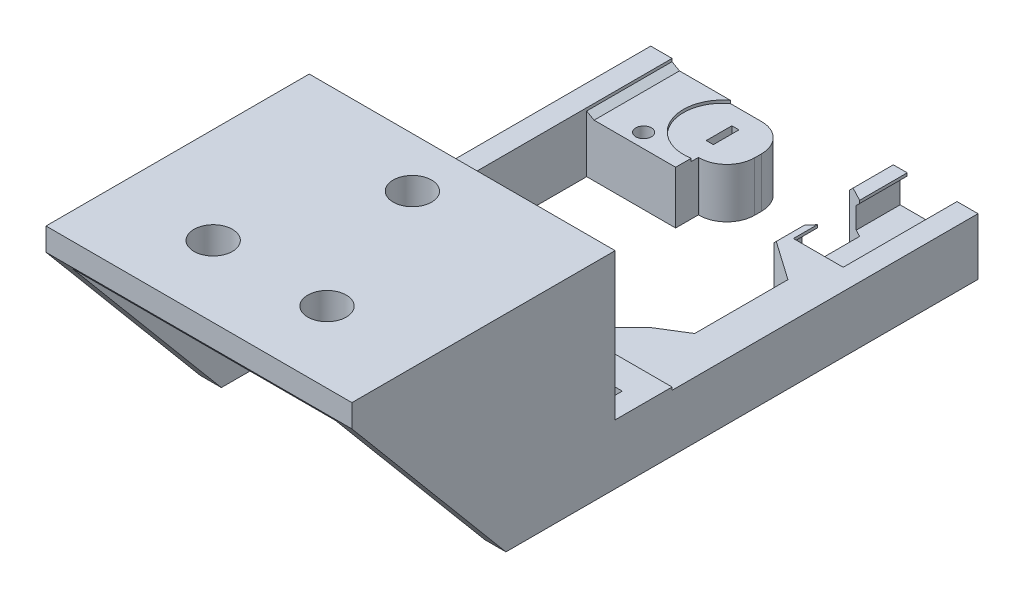
from build123d import *
from OCP.BRepFilletAPI import BRepFilletAPI_MakeChamfer

# Parameters (mm, degrees)
SKETCH1_W                       = 3
SKETCH1_H                       = 37
SKETCH1_H_2                     = 48
BOSS_EXTRUDE1_DEPTH             = 8
SKETCH4_W                       = 19.5
SKETCH4_H                       = 8.8
BOSS_EXTRUDE3_DEPTH             = 6.6
SERVO_HOLDER_DEPTH              = 0.4
SERVO_HOLDER_DEPTH_BACK         = 7
SKETCH3_W                       = 15.5
SKETCH3_H                       = 4
SKETCH3_R                       = 1.04
SKETCH5_W                       = 1
SKETCH5_H                       = 3.6
CUT_EXTRUDE2_DEPTH              = 70.647801738
SKETCH11_W                      = 43
SKETCH11_H                      = 4
BOSS_EXTRUDE9_DEPTH             = 8
BOSS_EXTRUDE9_DIRECTION_2_REACH = 71.601
SKETCH14_W                      = 12.223643904
SKETCH14_H                      = 44.979564252
CUT_EXTRUDE5_DEPTH              = 10
FILLET2_R                       = 3.9
CUT_EXTRUDE4_DEPTH              = 70.647801738
CUT_EXTRUDE4_DEPTH_BACK         = 70.647801738
SKETCH13_R                      = 1.1
SKETCH17_W                      = 12.9
SKETCH17_H                      = 8
BOSS_EXTRUDE11_DEPTH            = 27
BOSS_EXTRUDE12_DEPTH            = 16
SKETCH18_W                      = 1
SKETCH18_H                      = 3.6
SKETCH18_W_2                    = 3
SKETCH18_H_2                    = 24
SKETCH18_H_3                    = 41
BOSS_EXTRUDE13_DEPTH            = 0.4
CHAMFER14_SIZE                  = 1.2
CUT_EXTRUDE6_DEPTH              = 73.439806169
CUT_EXTRUDE6_DEPTH_BACK         = 73.439806169
SKETCH22_W                      = 43
SKETCH22_H                      = 37
SKETCH22_R                      = 2.7
MOUNT_TOP_DEPTH                 = 4
SKETCH23_W                      = 37
SKETCH23_H                      = 29
MOUNT_SIDE1_DEPTH               = 3
SKETCH24_W                      = 37
SKETCH24_H                      = 29
MOUNT_SIDE2_DEPTH               = 3
CHAMFER20_SIZE                  = 21.648770484
CHAMFER20_SIZE_2                = 25.8
SKETCH29_W                      = 8.885937164
SKETCH29_H                      = 8
BOSS_EXTRUDE20_DEPTH            = 0.4
CHAMFER23_SIZE                  = 1
CHAMFER24_SIZE                  = 1
CHAMFER24_SIZE2                 = 3.099667104
SKETCH26_R                      = 5.5
CUT_EXTRUDE8_DEPTH              = 10
CHAMFER25_SIZE                  = 0.6
CHAMFER25_SIZE2                 = 1.039230485


with BuildPart() as part:
    # Sketch1 → Boss-Extrude1 (new body)
    with BuildSketch(Plane(origin=(0, 0, 0), x_dir=(1, 0, 0), z_dir=(0, 1, 0))):
        with Locations((-20, -0.788461538)):
            Rectangle(SKETCH1_W, SKETCH1_H)
        with Locations((-20, 41.711538462)):
            Rectangle(SKETCH1_W, SKETCH1_H_2)
        with Locations((20, -0.788461538)):
            Rectangle(SKETCH1_W, SKETCH1_H)
        with Locations((20, 41.711538462)):
            Rectangle(SKETCH1_W, SKETCH1_H_2)
    extrude(amount=-BOSS_EXTRUDE1_DEPTH)

    # Sketch4 → Boss-Extrude3 (add)
    with BuildSketch(Plane.XZ.offset(8)):
        with Locations((-11.75, -61.311538462)):
            Rectangle(SKETCH4_W, SKETCH4_H)
    extrude(amount=-BOSS_EXTRUDE3_DEPTH)

    # Sketch3 → Servo Holder (add, two sides: drawn at the far end of the back side and taken through both)
    # profile 1 of 2: a face of its own
    with BuildSketch(Plane.XZ.offset(8).offset(-SERVO_HOLDER_DEPTH_BACK)):
        with Locations((-13.75, -55.711538462)):
            Rectangle(SKETCH3_W, SKETCH3_H)
        with Locations(Location((-12.5, -55.711538462, 0), (0, 0, 270))):
            Circle(SKETCH3_R, mode=Mode.SUBTRACT)
    # profile 2 of 2: a face of its own
    with BuildSketch(Plane.XZ.offset(8).offset(-SERVO_HOLDER_DEPTH_BACK)):
        with Locations((-13.75, -27.711538462)):
            Rectangle(SKETCH3_W, SKETCH3_H)
        with Locations(Location((-12.5, -27.711538462, 0), (0, 0, 90))):
            Circle(SKETCH3_R, mode=Mode.SUBTRACT)
    extrude(amount=SERVO_HOLDER_DEPTH + SERVO_HOLDER_DEPTH_BACK)

    # Sketch5 → Cut-Extrude2 (cut, through all)
    with BuildSketch(Plane(origin=(0, 0, 0), x_dir=(1, 0, 0), z_dir=(0, 1, 0))):
        with Locations((-7, 61.311538462)):
            Rectangle(SKETCH5_W, SKETCH5_H)
    extrude(amount=-CUT_EXTRUDE2_DEPTH, mode=Mode.SUBTRACT)

    # Sketch11 → Boss-Extrude9 (add)
    with BuildSketch(Plane.XZ.offset(8)):
        with Locations((0, -23.711538462)):
            Rectangle(SKETCH11_W, SKETCH11_H)
    extrude(amount=-BOSS_EXTRUDE9_DEPTH)

    # Boss-Extrude9 direction 2: up to this face of the body (flat: up to its plane)
    boss_extrude9_direction_2_end = Plane(part.part.faces().sort_by_distance((-13.822479257, -8.4, -55.711538462))[0])
    # Sketch11 → Boss-Extrude9 direction 2 (add, up to the picked face)
    with BuildSketch(Plane.XZ.offset(8), mode=Mode.PRIVATE) as boss_extrude9_direction_2_sk1:
        with Locations((0, -23.711538462)):
            Rectangle(SKETCH11_W, SKETCH11_H)
    boss_extrude9_direction_2_tool1 = split(extrude(boss_extrude9_direction_2_sk1.sketch, amount=BOSS_EXTRUDE9_DIRECTION_2_REACH, mode=Mode.PRIVATE), bisect_by=boss_extrude9_direction_2_end, keep=Keep.BOTH, mode=Mode.PRIVATE)
    add(boss_extrude9_direction_2_tool1.solids().sort_by(Axis((0, -8, -23.711538), (0, -1, 0)))[0])

    # Sketch14 → Cut-Extrude5 (cut)
    with BuildSketch(Plane.XZ.offset(8)):
        with Locations((24.611821952, -48.201320588)):
            Rectangle(SKETCH14_W, SKETCH14_H)
    extrude(amount=-CUT_EXTRUDE5_DEPTH, mode=Mode.SUBTRACT)

    # Fillet2
    fillet2_edges = [part.edges().sort_by_distance(p)[0] for p in [
        (-2, -4.7, -65.711538462),
        (-2, -4.7, -56.911538462),
    ]]
    fillet(fillet2_edges, radius=FILLET2_R)

    # Sketch13 → Cut-Extrude4 (cut, two sides: drawn at the far end of the back side and taken through both)
    with BuildSketch(Plane(origin=(0, -8.4, 0), x_dir=(-1, 0, 0), z_dir=(0, -1, 0)).offset(-CUT_EXTRUDE4_DEPTH_BACK)):
        with Locations(Location((12.5, 55.711538462, 0), (0, 0, 270))):
            Circle(SKETCH13_R)
        with Locations(Location((12.5, 27.711538462, 0), (0, 0, 270))):
            Circle(SKETCH13_R)
    extrude(amount=CUT_EXTRUDE4_DEPTH + CUT_EXTRUDE4_DEPTH_BACK, mode=Mode.SUBTRACT)

    # Sketch17 → Boss-Extrude11 (add)
    with BuildSketch(Plane(origin=(0, 0, -25.711538462), x_dir=(-1, 0, 0), z_dir=(0, 0, -1))):
        with Locations((-15.05, -4.4)):
            Rectangle(SKETCH17_W, SKETCH17_H)
    extrude(amount=BOSS_EXTRUDE11_DEPTH)

    # Sketch16 → Boss-Extrude12 (add)
    with BuildSketch(Plane(origin=(0, 0, -52.711538462), x_dir=(-1, 0, 0), z_dir=(0, 0, -1))):
        Polygon((-19.75, -2), (-18.55, -2), (-18.55, -0.4), (-21.5, -0.4), (-21.5, -8.4), (-8.6, -8.4), (-8.6, -0.4), (-11.55, -0.4), (-11.55, -2), (-10.55, -2), (-10.55, -4.8), (-19.75, -4.8), align=None)
    extrude(amount=BOSS_EXTRUDE12_DEPTH)

    # Sketch18 → Boss-Extrude13 (add)
    # profile 1 of 4: a face of its own
    with BuildSketch(Plane.XZ.offset(8)):
        with BuildLine():
            Line((-21.5, -57.711538462), (-21.5, -65.711538462))
            Line((-21.5, -65.711538462), (-5.9, -65.711538462))
            ThreePointArc((-5.9, -65.711538462), (-3.142283553, -64.569254908), (-2, -61.811538462))
            Line((-2, -61.811538462), (-2, -60.811538462))
            ThreePointArc((-2, -60.811538462), (-3.142283553, -58.053822015), (-5.9, -56.911538462))
            Line((-5.9, -56.911538462), (-6, -56.911538462))
            Line((-6, -56.911538462), (-6, -57.711538462))
            Line((-6, -57.711538462), (-21.5, -57.711538462))
        make_face()
        with Locations((-7, -61.311538462)):
            Rectangle(SKETCH18_W, SKETCH18_H, mode=Mode.SUBTRACT)
    # profile 2 of 4: a face of its own
    with BuildSketch(Plane.XZ.offset(8)):
        with Locations((-20, -41.711538462)):
            Rectangle(SKETCH18_W_2, SKETCH18_H_2)
    # profile 3 of 4: a face of its own
    with BuildSketch(Plane.XZ.offset(8)):
        with Locations((-20, -1.211538462)):
            Rectangle(SKETCH18_W_2, SKETCH18_H_3)
    # profile 4 of 4: a face of its own
    with BuildSketch(Plane.XZ.offset(8)):
        with Locations((20, -1.211538462)):
            Rectangle(SKETCH18_W_2, SKETCH18_H_3)
    extrude(amount=BOSS_EXTRUDE13_DEPTH)

    # Chamfer14
    # the kernel refuses this chamfer: 1.2 mm, written as the material it takes off along each edge
    with BuildSketch(Plane(origin=(18.55, -2, -52.711538462), x_dir=(0.9996219169112968, -0.027495876610586622, 0), z_dir=(0, 0, -1))) as chamfer14_piece_1_section:
        Polygon((CHAMFER14_SIZE * 0.999621916911, -CHAMFER14_SIZE * 0.0274958766106), (-CHAMFER14_SIZE * 0.0274958766106, -CHAMFER14_SIZE * 0.999621916911), (0, 0), align=None)
    chamfer14_piece_1 = extrude(amount=19.086019586, mode=Mode.PRIVATE)
    chamfer14_piece_1 = split(chamfer14_piece_1, bisect_by=Plane(origin=(19.75, -1.603515015, -62.254548254), z_dir=(-1, 0, 0)), keep=Keep.TOP, mode=Mode.PRIVATE)
    add(chamfer14_piece_1, mode=Mode.SUBTRACT)
    with BuildSketch(Plane(origin=(11.55, -2, -52.711538462), x_dir=(0.027495876610585914, 0.9996219169112968, 0), z_dir=(0, 0, -1))) as chamfer14_piece_2_section:
        Polygon((CHAMFER14_SIZE * 0.999621916911, -CHAMFER14_SIZE * 0.0274958766106), (-CHAMFER14_SIZE * 0.0274958766106, -CHAMFER14_SIZE * 0.999621916911), (0, 0), align=None)
    chamfer14_piece_2 = extrude(amount=19.086019586, mode=Mode.PRIVATE)
    chamfer14_piece_2 = split(chamfer14_piece_2, bisect_by=Plane(origin=(10.55, -1.589568171, -62.254548254), z_dir=(1, 0, 0)), keep=Keep.TOP, mode=Mode.PRIVATE)
    add(chamfer14_piece_2, mode=Mode.SUBTRACT)

    # Sketch20 → Cut-Extrude6 (cut, two sides: drawn at the far end of the back side and taken through both)
    with BuildSketch(Plane(origin=(0, -0.4, 0), x_dir=(1, 0, 0), z_dir=(0, 1, 0)).offset(-CUT_EXTRUDE6_DEPTH_BACK)):
        Polygon((8.6, 53.963605621), (8.6, 63.570761525), (2.515498959, 66.765310983), (1.997773223, 58.659131413), (1.997773223, 53.963605621), (4.974693998, 53.963605621), (4.974693998, 55.162371456), (6.687222193, 53.963605621), align=None)
        Polygon((8.6, 52.700948092), (8.6, 53.963605621), (6.687222193, 53.963605621), (8.558718605, 52.653562397), align=None)
        Polygon((16.174786864, 47.322331969), (9.7, 51.854668021), (9.7, 30.195176122), (16.174786864, 34.211808124), align=None)
        Polygon((4.974693998, 53.963605621), (6.687222193, 53.963605621), (4.974693998, 55.162371456), align=None)
        Polygon((11.55, 56.087166011), (11.55, 62.021921145), (8.6, 63.570761525), (8.6, 53.963605621), (9.7, 53.963605621), align=None)
        Polygon((8.6, 52.624665515), (8.6, 52.700948092), (8.558718605, 52.653562397), align=None)
        Polygon((9.7, 25.711538462), (9.7, 30.195176122), (8.6, 29.512791467), (8.6, 25.711538462), align=None)
        Polygon((9.7, 53.963605621), (8.6, 53.963605621), (8.6, 52.700948092), align=None)
        Polygon((9.7, 51.854668021), (9.7, 53.963605621), (8.6, 52.700948092), (8.6, 52.624665515), align=None)
        Polygon((8.558718605, 52.653562397), (6.687222193, 53.963605621), (4.974693998, 53.963605621), (4.974693998, 48.539566347), align=None)
        Polygon((9.7, 30.195176122), (9.7, 51.854668021), (8.6, 52.624665515), (8.6, 29.512791467), align=None)
        Polygon((8.6, 52.624665515), (8.558718605, 52.653562397), (4.974693998, 48.539566347), (4.974693998, 27.263834025), (8.6, 29.512791467), align=None)
    extrude(amount=CUT_EXTRUDE6_DEPTH + CUT_EXTRUDE6_DEPTH_BACK, mode=Mode.SUBTRACT)



with BuildPart() as body_2:
    # Sketch22 → Mount Top (new body)
    with BuildSketch(Plane(origin=(0, 20.6, 0), x_dir=(1, 0, 0), z_dir=(0, 1, 0))):
        with Locations((0, -0.788461538)):
            Rectangle(SKETCH22_W, SKETCH22_H)
        with Locations(Location((0, 10.711538462, 0), (0, 0, 270))):
            Circle(SKETCH22_R, mode=Mode.SUBTRACT)
        with Locations(Location((8, -9.288461538, 0), (0, 0, 270))):
            Circle(SKETCH22_R, mode=Mode.SUBTRACT)
        with Locations(Location((-8, -9.288461538, 0), (0, 0, 90))):
            Circle(SKETCH22_R, mode=Mode.SUBTRACT)
    extrude(amount=-MOUNT_TOP_DEPTH)


with BuildPart() as part_1:
    add(part.part)

    add(body_2.part)  # Mount Side1 merges body 2
    # Sketch23 → Mount Side1 (add)
    with BuildSketch(Plane.ZY.offset(21.5)):
        with Locations((0.788461538, 6.1)):
            Rectangle(SKETCH23_W, SKETCH23_H)
    extrude(amount=-MOUNT_SIDE1_DEPTH)

    # Sketch24 → Mount Side2 (add)
    with BuildSketch(Plane(origin=(21.5, 0, 0), x_dir=(0, 0, -1), z_dir=(1, 0, 0))):
        with Locations((-0.788461538, 6.1)):
            Rectangle(SKETCH24_W, SKETCH24_H)
    extrude(amount=-MOUNT_SIDE2_DEPTH)

    # Chamfer20
    # the kernel refuses this chamfer: 25.8, 21.648770484 mm, written as the material it takes off along each edge
    with BuildSketch(Plane(origin=(87.997077466, -8.4, 19.288461538), x_dir=(0, -0.03540953691366264, -0.9993728857116146), z_dir=(-1, 0, 0)), Plane(origin=(47.997077466, -8.4, 19.288461538), x_dir=(0, -0.03540953691366264, -0.9993728857116146), z_dir=(-1, 0, 0))) as chamfer20_piece_1:
        Polygon((CHAMFER20_SIZE * 0.999372885729, -CHAMFER20_SIZE * 0.0354095369143), (-CHAMFER20_SIZE_2 * 0.0354095369137, -CHAMFER20_SIZE_2 * 0.999372885712), (0, 0), align=None)
    extrude(amount=135.994154933, mode=Mode.SUBTRACT)

    # Sketch29 → Boss-Extrude20 (add)
    with BuildSketch(Plane(origin=(0, -1.4, 0), x_dir=(1, 0, 0), z_dir=(0, 1, 0))):
        with Locations((-14.057031418, 61.711538462)):
            Rectangle(SKETCH29_W, SKETCH29_H)
    extrude(amount=BOSS_EXTRUDE20_DEPTH)

    # Chamfer23
    chamfer23_edges = [part_1.edges().sort_by_distance(p)[0] for p in [
        (9.7, -0.4, -52.909136821),
    ]]
    chamfer(chamfer23_edges, length=CHAMFER23_SIZE)

    # Chamfer24: one chamfer whose edges measure the first distance from different faces: ONE call of the kernel's chamfer builder (chamfer() names one face for all edges)
    chamfer24_edges_1 = [part_1.edges().sort_by_distance(p)[0] for p in [
        (8.6, -0.4, -66.141149993),
        (-6, -4.7, -29.711538462),
    ]]
    chamfer24_edges_2 = [part_1.edges().sort_by_distance(p)[0] for p in [
        (9.7, -4.4, -30.195176122),
    ]]
    chamfer24_side_2 = [part_1.faces().sort_by_distance(p)[0] for p in [
        (9.7, -4.4, -27.953357292),
    ]]
    chamfer24 = BRepFilletAPI_MakeChamfer(part_1.part.solid().wrapped)
    for e in chamfer24_edges_1:
        chamfer24.Add(CHAMFER24_SIZE, e.wrapped)
    for e in chamfer24_edges_2:
        chamfer24.Add(CHAMFER24_SIZE, CHAMFER24_SIZE2, e.wrapped, chamfer24_side_2[0].wrapped)  # the first distance lies on this face
    add(Compound.cast(chamfer24.Shape()), mode=Mode.REPLACE)

    # Sketch26 → Cut-Extrude8 (cut)
    with BuildSketch(Plane(origin=(0, -1.4, 0), x_dir=(1, 0, 0), z_dir=(0, 1, 0))):
        with Locations((-7, 61.311538462)):
            Circle(SKETCH26_R)
    extrude(amount=CUT_EXTRUDE8_DEPTH, mode=Mode.SUBTRACT)

    # Chamfer25
    chamfer25_edges = [part_1.edges().sort_by_distance(p)[0] for p in [
        (-18.5, -1, -59.711538462),
    ]]
    chamfer25_side = [part_1.faces().sort_by_distance(p)[0] for p in [
        (-18.5, -3.927941176, -42.446832579),
    ]]
    chamfer(chamfer25_edges, length=CHAMFER25_SIZE, length2=CHAMFER25_SIZE2, reference=chamfer25_side[0])


solid = part_1.part
